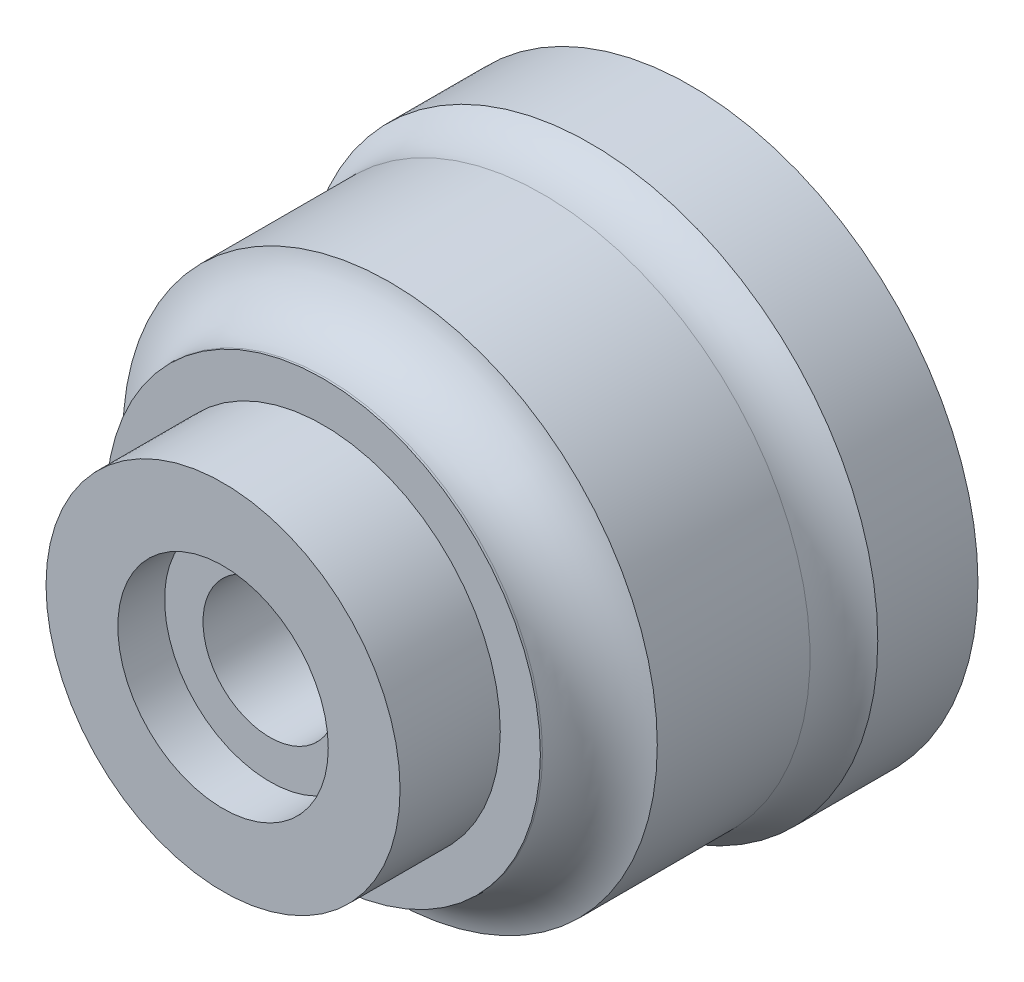
from build123d import *

# Parameters (mm, degrees)
SKETCH_1_R          = 43
SKETCH_1_R_2        = 18.9
EXTRUDE_1_DEPTH     = 15
SKETCH_3_R          = 40
SKETCH_3_R_2        = 19
EXTRUDE_2_DEPTH     = 30
SKETCH_7_R          = 32.5
SKETCH_7_R_2        = 10
EXTRUDE_3_DEPTH     = 10
FILLET_3_R          = 10
SKETCH_9_R          = 16
SKETCH_9_R_2        = 10
EXTRUDE_6_DEPTH     = 7
SKETCH_10_R         = 26.5
SKETCH_10_R_2       = 10
EXTRUDE_7_DEPTH     = 15
SKETCH_12_R         = 15.75
CUT_EXTRUDE_8_DEPTH = 7
FILLET_4_R          = 10


with BuildPart() as part:
    # Эскиз1 → Вытянуть1 (new body)
    with BuildSketch(Plane.XY):
        Circle(SKETCH_1_R)
        Circle(SKETCH_1_R_2, mode=Mode.SUBTRACT)
    extrude(amount=EXTRUDE_1_DEPTH)

    # Эскиз3 → Вытянуть2 (add)
    with BuildSketch(Plane.XY.offset(15)):
        Circle(SKETCH_3_R)
        Circle(SKETCH_3_R_2, mode=Mode.SUBTRACT)
    extrude(amount=EXTRUDE_2_DEPTH)

    # Эскиз7 → Вытянуть3 (add)
    with BuildSketch(Plane.XY.offset(45)):
        Circle(SKETCH_7_R)
        Circle(SKETCH_7_R_2, mode=Mode.SUBTRACT)
    extrude(amount=EXTRUDE_3_DEPTH)

    # Скругление3
    # the kernel refuses this fillet: 10 mm, written as the material it adds along each edge
    with BuildSketch(Plane(origin=(0, 0, 15), x_dir=(1, 0, 0), z_dir=(0, -1, 0))) as fillet_3_piece_1:
        with BuildLine():
            CenterArc((50, 7.141428429), FILLET_3_R, 180, 45.572995999)
            Line((40, 7.141428429), (39.8, 7.141428429))
            Line((39.8, 7.141428429), (39.8, 0))
            Line((39.8, 0), (40, -0.2))
            ThreePointArc((40, -0.2), (41.5, -0.2), (42.86, -0.142828569))
            Line((42.86, -0.142828569), (43, 0))
        make_face()
    revolve(axis=Axis((0, 0, 15), (0, 0, 1)))



with BuildPart() as body_2:
    # Эскиз9 → Вытянуть6 (new body)
    with BuildSketch(Plane.XY.offset(48)):
        Circle(SKETCH_9_R)
        Circle(SKETCH_9_R_2, mode=Mode.SUBTRACT)
    extrude(amount=EXTRUDE_6_DEPTH)


with BuildPart() as part_1:
    add(part.part)

    add(body_2.part)  # Вытянуть7 merges body 2
    # Эскиз10 → Вытянуть7 (add)
    with BuildSketch(Plane.XY.offset(55)):
        Circle(SKETCH_10_R)
        Circle(SKETCH_10_R_2, mode=Mode.SUBTRACT)
    extrude(amount=EXTRUDE_7_DEPTH)

    # Эскиз12 → Вытянуть8 (cut)
    with BuildSketch(Plane.XY.offset(70)):
        Circle(SKETCH_12_R)
    extrude(amount=-CUT_EXTRUDE_8_DEPTH, mode=Mode.SUBTRACT)

    # Скругление4
    # the kernel refuses this fillet: 10 mm, written as the material it adds along each edge
    with BuildSketch(Plane(origin=(0, 0, 45), x_dir=(1, 0, 0), z_dir=(0, -1, 0))) as fillet_4_piece_1:
        with BuildLine():
            CenterArc((42.5, 9.682458366), FILLET_4_R, 180, 75.522487814)
            Line((32.5, 9.682458366), (32.3, 9.682458366))
            Line((32.3, 9.682458366), (32.3, 0))
            Line((32.3, 0), (32.5, -0.2))
            ThreePointArc((32.5, -0.2), (36.25, -0.2), (39.95, -0.193649167))
            Line((39.95, -0.193649167), (40, 0))
        make_face()
    revolve(axis=Axis((0, 0, 45), (0, 0, 1)))


solid = part_1.part
